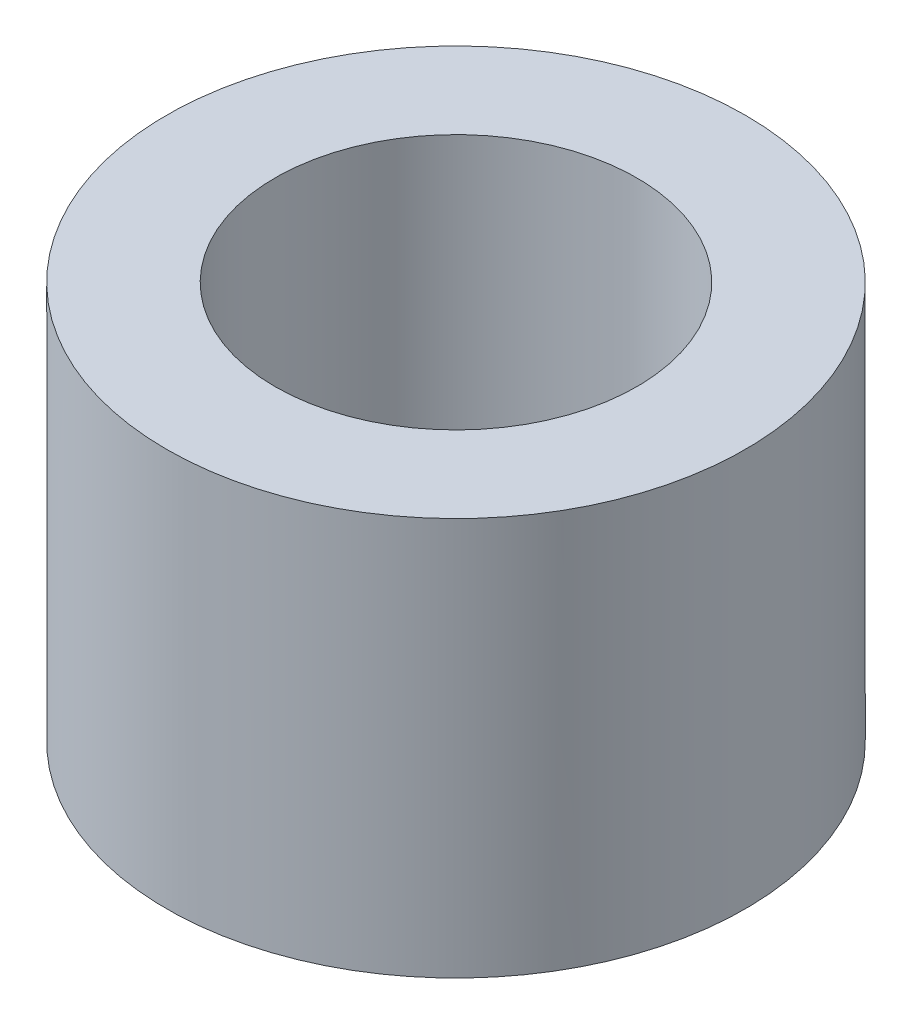
from build123d import *

# Parameters (mm, degrees)
SKETCH1_R           = 40
SKETCH1_R_2         = 25
BOSS_EXTRUDE1_DEPTH = 50
BOSS_EXTRUDE2_START = 5
SKETCH2_R           = 40
SKETCH2_R_2         = 37.5
BOSS_EXTRUDE2_DEPTH = 5


with BuildPart() as part:
    # Sketch1 → Boss-Extrude1 (new body)
    with BuildSketch(Plane(origin=(0, 0, 0), x_dir=(1, 0, 0), z_dir=(0, 1, 0))):
        Circle(SKETCH1_R)
        Circle(SKETCH1_R_2, mode=Mode.SUBTRACT)
    extrude(amount=BOSS_EXTRUDE1_DEPTH)

    # Sketch2 → Boss-Extrude2 (add)
    with BuildSketch(Plane.XZ.offset(BOSS_EXTRUDE2_START)):
        Circle(SKETCH2_R)
        Circle(SKETCH2_R_2, mode=Mode.SUBTRACT)
    extrude(amount=-BOSS_EXTRUDE2_DEPTH)


solid = part.part
